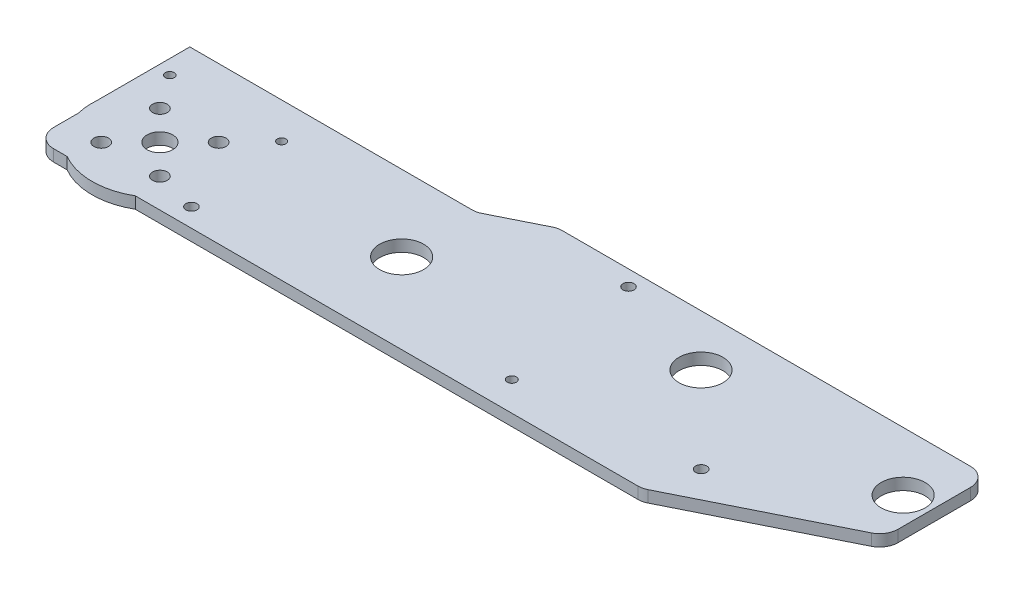
from build123d import *

# Parameters (mm, degrees)
SKETCH1_W           = 210
SKETCH1_H           = 50
SKETCH1_R           = 1.211665018
SKETCH1_R_2         = 1.165617118
SKETCH1_R_3         = 1.5
SKETCH1_R_4         = 1.25
SKETCH1_R_5         = 1.517273905
SKETCH1_R_6         = 3.4
BOSS_EXTRUDE1_DEPTH = 3.175
SKETCH2_R           = 2
CUT_EXTRUDE1_DEPTH  = 10
SKETCH3_R           = 6
SKETCH3_R_2         = 0.586995366
CUT_EXTRUDE2_DEPTH  = 57.15
CUT_EXTRUDE7_DEPTH  = 10
FILLET3_R           = 5
SKETCH11_R          = 18.5
SKETCH11_R_2        = 2
BOSS_EXTRUDE4_DEPTH = 3.175
SKETCH16_W          = 18.257640281
SKETCH16_H          = 3.175
BOSS_EXTRUDE7_DEPTH = 8.128
SKETCH17_W          = 33.3
SKETCH17_H          = 3.175
BOSS_EXTRUDE8_DEPTH = 35.56
SKETCH18_R          = 2
CUT_EXTRUDE8_DEPTH  = 9
SKETCH19_R          = 4
CUT_EXTRUDE9_DEPTH  = 40
FILLET4_R           = 5
SKETCH20_R          = 3.5
CUT_EXTRUDE10_DEPTH = 10
SKETCH21_R          = 1.5
CUT_EXTRUDE11_DEPTH = 10
SKETCH22_R          = 1.5
CUT_EXTRUDE12_DEPTH = 10
SKETCH24_R          = 1.5
CUT_EXTRUDE13_DEPTH = 10
SKETCH25_R          = 2
SKETCH25_R_2        = 1.5
SKETCH25_R_3        = 4
CUT_EXTRUDE14_DEPTH = 10


with BuildPart() as part:
    # Sketch1 → Boss-Extrude1 (new body)
    with BuildSketch(Plane(origin=(0, 0, 0), x_dir=(1, 0, 0), z_dir=(0, 1, 0))):
        with Locations((105, -25)):
            Rectangle(SKETCH1_W, SKETCH1_H)
        with Locations((3.489526233, -16.787661112)):
            Circle(SKETCH1_R, mode=Mode.SUBTRACT)
        with Locations((34.37258772, -17.194005245)):
            Circle(SKETCH1_R_2, mode=Mode.SUBTRACT)
        with Locations((37.520749958, -44.921198121)):
            Circle(SKETCH1_R_3, mode=Mode.SUBTRACT)
        with Locations((122, -42.058139805)):
            Circle(SKETCH1_R_4, mode=Mode.SUBTRACT)
        with Locations((168.975233936, -37.403209633)):
            Circle(SKETCH1_R_5, mode=Mode.SUBTRACT)
        with Locations((78.01026379, -28.1)):
            Circle(SKETCH1_R_6, mode=Mode.SUBTRACT)
    extrude(amount=BOSS_EXTRUDE1_DEPTH)

    # Sketch2 → Cut-Extrude1 (cut)
    with BuildSketch(Plane(origin=(0, 3.175, 0), x_dir=(1, 0, 0), z_dir=(0, 1, 0))):
        with Locations((10, -26)):
            Circle(SKETCH2_R)
        with Locations((10, -42)):
            Circle(SKETCH2_R)
        with Locations((26, -26)):
            Circle(SKETCH2_R)
        with Locations((26, -42)):
            Circle(SKETCH2_R)
    extrude(amount=-CUT_EXTRUDE1_DEPTH, mode=Mode.SUBTRACT)

    # Sketch3 → Cut-Extrude2 (cut)
    with BuildSketch(Plane(origin=(0, 3.175, 0), x_dir=(1, 0, 0), z_dir=(0, 1, 0))):
        with Locations((78.01026379, -28.1)):
            Circle(SKETCH3_R)
        with Locations((145.531297368, -14)):
            Circle(SKETCH3_R)
        with Locations((18, -34)):
            Circle(SKETCH3_R_2)
        with Locations((202.646291021, -16)):
            Circle(SKETCH3_R)
    extrude(amount=-CUT_EXTRUDE2_DEPTH, mode=Mode.SUBTRACT)

    # Sketch10 → Cut-Extrude7 (cut)
    with BuildSketch(Plane(origin=(0, 3.175, 0), x_dir=(1, 0, 0), z_dir=(0, 1, 0))):
        Polygon((210, -27.859435908), (165.502877994, -50), (210, -50), align=None)
        Polygon((92.532613397, 0), (77.65477062, -7.402812063), (0, -7.402812063), (0, 0), align=None)
    extrude(amount=-CUT_EXTRUDE7_DEPTH, mode=Mode.SUBTRACT)

    # Fillet3
    fillet3_edges = [part.edges().sort_by_distance(p)[0] for p in [
        (77.65477062, 1.5875, 7.402812063),
        (92.532613397, 1.5875, 0),
        (210, 1.5875, 0),
        (210, 1.5875, 27.859435908),
        (165.502877994, 1.5875, 50),
    ]]
    fillet(fillet3_edges, radius=FILLET3_R)

    # Sketch11 → Boss-Extrude4 (add)
    with BuildSketch(Plane(origin=(0, 3.175, 0), x_dir=(1, 0, 0), z_dir=(0, 1, 0))):
        with Locations((18, -34)):
            Circle(SKETCH11_R)
        with Locations((10, -26)):
            Circle(SKETCH11_R_2, mode=Mode.SUBTRACT)
        with Locations((10, -42)):
            Circle(SKETCH11_R_2, mode=Mode.SUBTRACT)
        with Locations((26, -26)):
            Circle(SKETCH11_R_2, mode=Mode.SUBTRACT)
        with Locations((26, -42)):
            Circle(SKETCH11_R_2, mode=Mode.SUBTRACT)
    extrude(amount=-BOSS_EXTRUDE4_DEPTH)

    # Sketch16 → Boss-Extrude7 (add)
    with BuildSketch(Plane(origin=(0, 0, 7.402812063), x_dir=(-1, 0, 0), z_dir=(0, 0, -1))):
        with Locations((-9.128820141, 1.5875)):
            Rectangle(SKETCH16_W, SKETCH16_H)
    extrude(amount=BOSS_EXTRUDE7_DEPTH)

    # Sketch17 → Boss-Extrude8 (add)
    with BuildSketch(Plane.ZY):
        with Locations((15.924812063, 1.5875)):
            Rectangle(SKETCH17_W, SKETCH17_H)
    extrude(amount=BOSS_EXTRUDE8_DEPTH)

    # Sketch18 → Cut-Extrude8 (cut)
    with BuildSketch(Plane(origin=(0, 3.175, 0), x_dir=(1, 0, 0), z_dir=(0, 1, 0))):
        with Locations((-29.612034681, -23.798543698)):
            Circle(SKETCH18_R)
        with Locations((-29.359661767, -7.798707515)):
            Circle(SKETCH18_R)
        with Locations((-13.359825583, -8.051080428)):
            Circle(SKETCH18_R)
        with Locations((-13.612198497, -24.050916612)):
            Circle(SKETCH18_R)
    extrude(amount=-CUT_EXTRUDE8_DEPTH, mode=Mode.SUBTRACT)

    # Sketch19 → Cut-Extrude9 (cut)
    with BuildSketch(Plane(origin=(0, 3.175, 0), x_dir=(1, 0, 0), z_dir=(0, 1, 0))):
        with Locations((-21.359661767, -15.798707515)):
            Circle(SKETCH19_R)
    extrude(amount=-CUT_EXTRUDE9_DEPTH, mode=Mode.SUBTRACT)

    # Fillet4
    fillet4_edges = [part.edges().sort_by_distance(p)[0] for p in [
        (0, 1.5875, 50),
        (18.257640281, 1.5875, -0.725187937),
        (-35.56, 1.5875, -0.725187937),
        (-35.56, 1.5875, 32.574812063),
    ]]
    fillet(fillet4_edges, radius=FILLET4_R)

    # Sketch20 → Cut-Extrude10 (cut)
    with BuildSketch(Plane(origin=(0, 3.175, 0), x_dir=(1, 0, 0), z_dir=(0, 1, 0))):
        with Locations((18, -34)):
            Circle(SKETCH20_R)
    extrude(amount=-CUT_EXTRUDE10_DEPTH, mode=Mode.SUBTRACT)

    # Sketch21 → Cut-Extrude11 (cut)
    with BuildSketch(Plane(origin=(0, 3.175, 0), x_dir=(1, 0, 0), z_dir=(0, 1, 0))):
        with Locations((116, -4.237214774)):
            Circle(SKETCH21_R)
    extrude(amount=-CUT_EXTRUDE11_DEPTH, mode=Mode.SUBTRACT)

    # Sketch22 → Cut-Extrude12 (cut)
    with BuildSketch(Plane(origin=(0, 3.175, 0), x_dir=(1, 0, 0), z_dir=(0, 1, 0))):
        with Locations((12.257640281, -3.274812063)):
            Circle(SKETCH22_R)
    extrude(amount=-CUT_EXTRUDE12_DEPTH, mode=Mode.SUBTRACT)

    # Sketch24 → Cut-Extrude13 (cut)
    with BuildSketch(Plane(origin=(0, 3.175, 0), x_dir=(1, 0, 0), z_dir=(0, 1, 0))):
        with Locations((-30.56, -15.774812063)):
            Circle(SKETCH24_R)
    extrude(amount=-CUT_EXTRUDE13_DEPTH, mode=Mode.SUBTRACT)

    # Sketch25 → Cut-Extrude14 (cut)
    with BuildSketch(Plane(origin=(0, 3.175, 0), x_dir=(1, 0, 0), z_dir=(0, 1, 0))):
        Polygon((-0.445022075, -32.574812063), (-0.445022075, -7.402812063), (19.796582413, -7.402812063), (19.796582413, 8.25362025), (-38.852523862, 8.25362025), (-38.852523862, -32.574812063), align=None)
        with Locations((-29.612034681, -23.798543698)):
            Circle(SKETCH25_R, mode=Mode.SUBTRACT)
        with Locations((-13.612198497, -24.050916612)):
            Circle(SKETCH25_R, mode=Mode.SUBTRACT)
        with Locations((-30.56, -15.774812063)):
            Circle(SKETCH25_R_2, mode=Mode.SUBTRACT)
        with Locations((-21.359661767, -15.798707515)):
            Circle(SKETCH25_R_3, mode=Mode.SUBTRACT)
        with Locations((-29.359661767, -7.798707515)):
            Circle(SKETCH25_R, mode=Mode.SUBTRACT)
        with Locations((-13.359825583, -8.051080428)):
            Circle(SKETCH25_R, mode=Mode.SUBTRACT)
        with Locations((12.257640281, -3.274812063)):
            Circle(SKETCH25_R_2, mode=Mode.SUBTRACT)
    extrude(amount=-CUT_EXTRUDE14_DEPTH, mode=Mode.SUBTRACT)


solid = part.part
